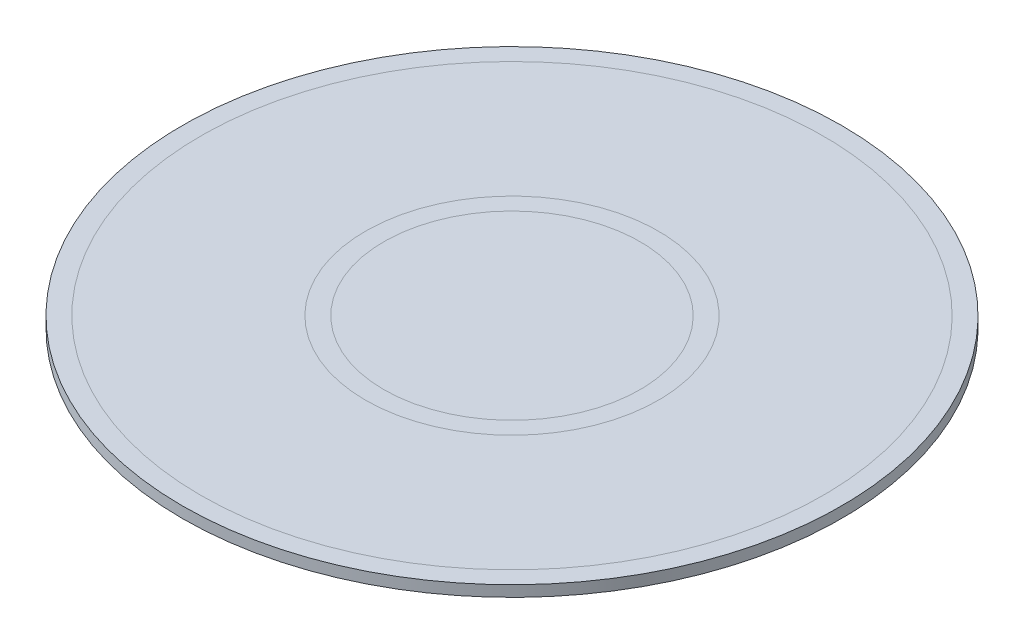
from build123d import *

# Parameters (mm, degrees)
SKETCH1_R           = 9
BOSS_EXTRUDE1_DEPTH = 0.3


with BuildPart() as part:
    # Sketch1 → Boss-Extrude1 (new body)
    with BuildSketch(Plane(origin=(0, 0, 0), x_dir=(1, 0, 0), z_dir=(0, 1, 0))):
        Circle(SKETCH1_R)
    extrude(amount=BOSS_EXTRUDE1_DEPTH)


solid = part.part
